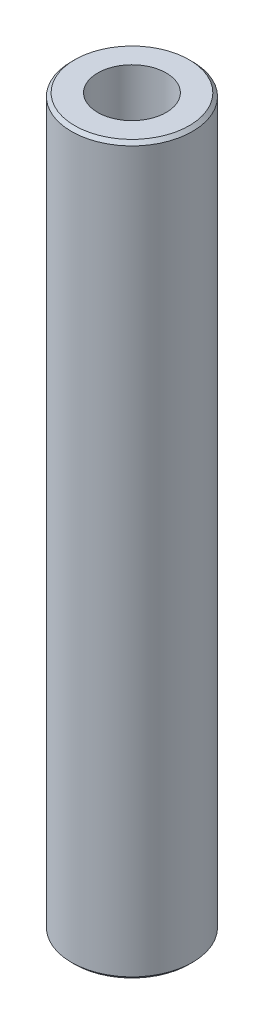
from build123d import *

# Parameters (mm, degrees)
SKETCH1_R           = 50
BOSS_EXTRUDE1_DEPTH = 600
SKETCH2_R           = 28.301035696
CUT_EXTRUDE1_DEPTH  = 605.15229868
CHAMFER1_SIZE       = 2.741344269


with BuildPart() as part:
    # Sketch1 → Boss-Extrude1 (new body)
    with BuildSketch(Plane(origin=(0, 0, 0), x_dir=(1, 0, 0), z_dir=(0, 1, 0))):
        Circle(SKETCH1_R)
    extrude(amount=BOSS_EXTRUDE1_DEPTH)

    # Sketch2 → Cut-Extrude1 (cut, through all)
    with BuildSketch(Plane(origin=(0, 0, 0), x_dir=(1, 0, 0), z_dir=(0, 1, 0))):
        Circle(SKETCH2_R)
    extrude(amount=CUT_EXTRUDE1_DEPTH, mode=Mode.SUBTRACT)

    # Chamfer1
    chamfer1_edges = [part.edges().sort_by_distance(p)[0] for p in [
        (-50, 600, 0),
        (-50, 0, 0),
    ]]
    chamfer(chamfer1_edges, length=CHAMFER1_SIZE)


solid = part.part
